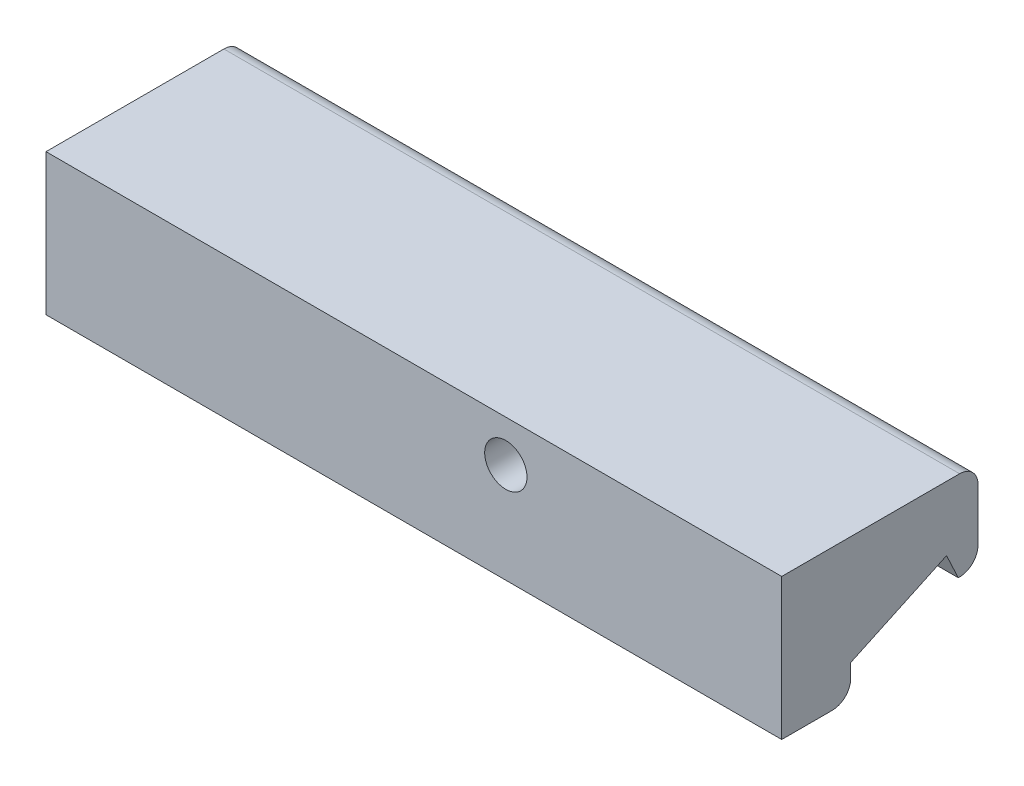
from build123d import *

# Parameters (mm, degrees)
PROFILEBOSS_EXTRUDE1_DEPTH           = 80
SKETCH2_R                            = 2.3
LEDSTRIPMOUNTHOLESCUT_EXTRUDE1_DEPTH = 4.5
SKETCH3_R                            = 2.3
MOUNTINGHOLESCUT_EXTRUDE3_DEPTH      = 4.5


with BuildPart() as part:
    # Sketch1 → ProfileBoss-Extrude1 (new body)
    with BuildSketch(Plane(origin=(0, 0, 0), x_dir=(0, 0, -1), z_dir=(1, 0, 0))):
        with BuildLine():
            Line((0, 0), (5.499461553, 0))
            ThreePointArc((5.499461553, 0), (6.914055855, 0.585944145), (7.5, 2.000538447))
            Line((7.5, 2.000538447), (7.5, 3.5))
            Line((7.5, 3.5), (17.922539551, 8.36011001))
            Line((17.922539551, 8.36011001), (19.190394336, 5.641186649))
            ThreePointArc((19.190394336, 5.641186649), (20.700753359, 6.16912635), (21.340729536, 7.635528477))
            Line((21.340729536, 7.635528477), (21.340729536, 13.36011001))
            ThreePointArc((21.340729536, 13.36011001), (20.754943098, 14.774323572), (19.340729536, 15.36011001))
            Line((19.340729536, 15.36011001), (0, 15.36011001))
            Line((0, 15.36011001), (0, 0))
        make_face()
    extrude(amount=PROFILEBOSS_EXTRUDE1_DEPTH)

    # Sketch2 → LedStripMountHolesCut-Extrude1 (cut)
    with BuildSketch(Plane(origin=(0, 0.002211655, 0.001031312), x_dir=(1, 0, 0), z_dir=(0, -0.906307787036651, -0.4226182617406973))):
        with Locations((36.15, -14.026472319)):
            Circle(SKETCH2_R)
    extrude(amount=-LEDSTRIPMOUNTHOLESCUT_EXTRUDE1_DEPTH, mode=Mode.SUBTRACT)

    # Sketch3 → MountingHolesCut-Extrude3 (cut)
    with BuildSketch(Plane.XY):
        with Locations((50, 10.86011001)):
            Circle(SKETCH3_R)
    extrude(amount=-MOUNTINGHOLESCUT_EXTRUDE3_DEPTH, mode=Mode.SUBTRACT)


solid = part.part
